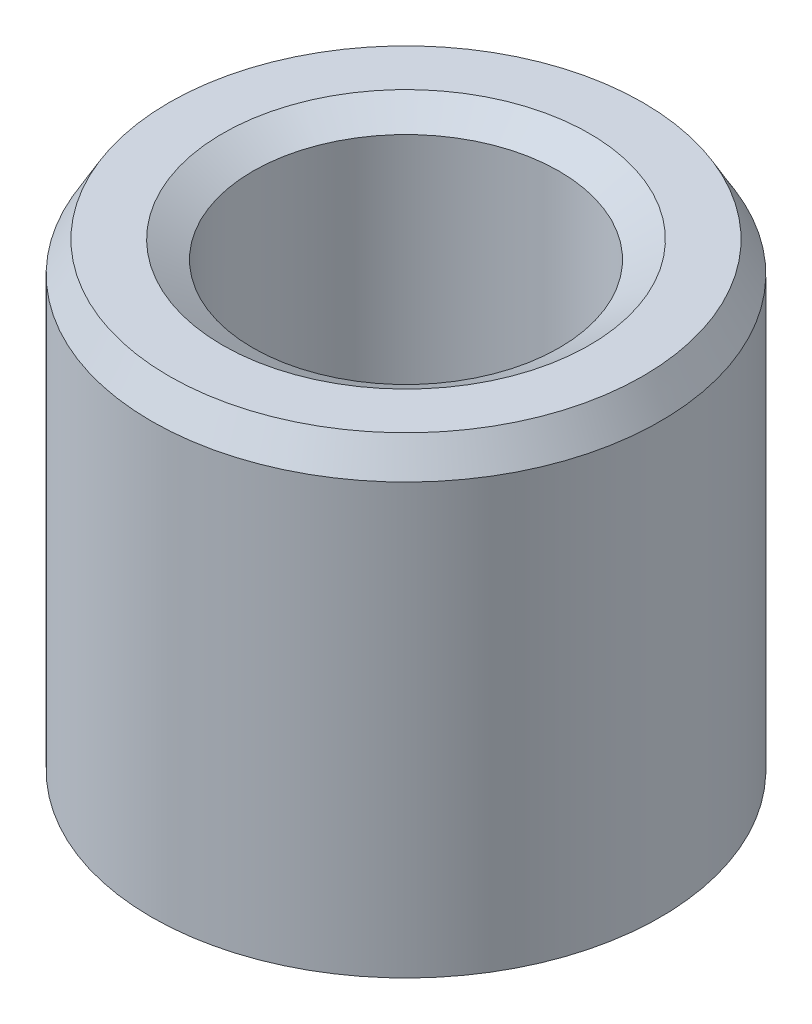
from build123d import *
from OCP.BRepFilletAPI import BRepFilletAPI_MakeChamfer

# Parameters (mm, degrees)
SKETCH1_R           = 10
BOSS_EXTRUDE1_DEPTH = 18.758691429
SKETCH2_R           = 6.017573051
CUT_EXTRUDE1_DEPTH  = 24.492307339
CHAMFER1_SIZE       = 1.191186069
CHAMFER1_SIZE2      = 0.687731598


with BuildPart() as part:
    # Sketch1 → Boss-Extrude1 (new body)
    with BuildSketch(Plane(origin=(0, 0, 0), x_dir=(1, 0, 0), z_dir=(0, 1, 0))):
        Circle(SKETCH1_R)
    extrude(amount=BOSS_EXTRUDE1_DEPTH)

    # Sketch2 → Cut-Extrude1 (cut, through all)
    with BuildSketch(Plane(origin=(0, 0, 0), x_dir=(1, 0, 0), z_dir=(0, 1, 0))):
        Circle(SKETCH2_R)
    extrude(amount=CUT_EXTRUDE1_DEPTH, mode=Mode.SUBTRACT)

    # Chamfer1: one chamfer whose edges measure the first distance from different faces: ONE call of the kernel's chamfer builder (chamfer() names one face for all edges)
    chamfer1_edges_1 = [part.edges().sort_by_distance(p)[0] for p in [
        (-6.017573051, 18.758691429, 0),
    ]]
    chamfer1_side_1 = [part.faces().sort_by_distance(p)[0] for p in [
        (-9.717157288, 18.758691429, 0),
    ]]
    chamfer1_edges_2 = [part.edges().sort_by_distance(p)[0] for p in [
        (-6.017573051, 0, 0),
    ]]
    chamfer1_side_2 = [part.faces().sort_by_distance(p)[0] for p in [
        (-6.017573051, 9.379345715, 0),
    ]]
    chamfer1_edges_3 = [part.edges().sort_by_distance(p)[0] for p in [
        (-10, 0, 0),
    ]]
    chamfer1_side_3 = [part.faces().sort_by_distance(p)[0] for p in [
        (-9.717157288, 0, 0),
    ]]
    chamfer1_edges_4 = [part.edges().sort_by_distance(p)[0] for p in [
        (-10, 18.758691429, 0),
    ]]
    chamfer1_side_4 = [part.faces().sort_by_distance(p)[0] for p in [
        (-10, 9.379345715, 0),
    ]]
    chamfer1 = BRepFilletAPI_MakeChamfer(part.part.solid().wrapped)
    for e in chamfer1_edges_1:
        chamfer1.Add(CHAMFER1_SIZE, CHAMFER1_SIZE2, e.wrapped, chamfer1_side_1[0].wrapped)  # the first distance lies on this face
    for e in chamfer1_edges_2:
        chamfer1.Add(CHAMFER1_SIZE, CHAMFER1_SIZE2, e.wrapped, chamfer1_side_2[0].wrapped)  # the first distance lies on this face
    for e in chamfer1_edges_3:
        chamfer1.Add(CHAMFER1_SIZE, CHAMFER1_SIZE2, e.wrapped, chamfer1_side_3[0].wrapped)  # the first distance lies on this face
    for e in chamfer1_edges_4:
        chamfer1.Add(CHAMFER1_SIZE, CHAMFER1_SIZE2, e.wrapped, chamfer1_side_4[0].wrapped)  # the first distance lies on this face
    add(Compound.cast(chamfer1.Shape()), mode=Mode.REPLACE)


solid = part.part
